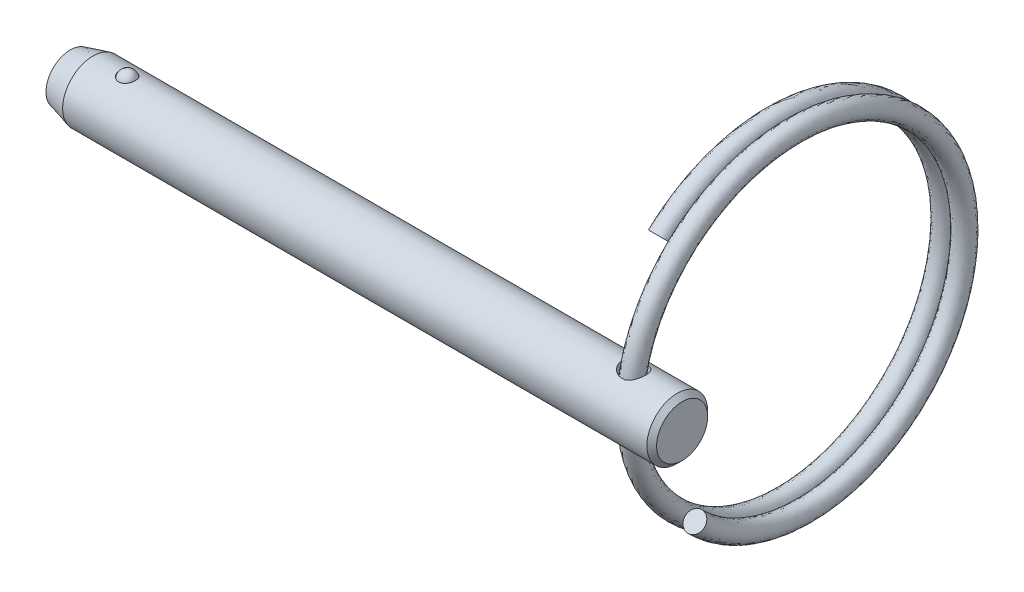
from build123d import *

# Parameters (mm, degrees)
SKETCH4_W             = 0.9525
SKETCH4_H             = 4.7625
SWEEP1_PITCH          = 1.5494
SWEEP1_HEIGHT         = 1.355725
SWEEP1_RADIUS         = 13.462
SKETCH6_R             = 0.762
SWEEP2_PITCH          = 1.5494
SWEEP2_HEIGHT         = 1.355725
SWEEP2_RADIUS         = 13.462
SWEEP2_START_ANGLE    = -180
SKETCH6_2_R           = 0.762
BODY_MOVE_COPY1_ANGLE = 90


with BuildPart() as part:
    # Sketch1 → Revolve1 (revolve)
    with BuildSketch(Plane.XY, mode=Mode.PRIVATE) as revolve1_sk:
        Polygon((23.9649, 2.00025), (23.5839, 2.38125), (-22.187510803, 2.38125), (-23.9649, 1.905), (-23.9649, 0), (23.9649, 0), align=None)
    revolve(revolve1_sk.sketch.rotate(Axis((23.9649, 0, 0), (1, 0, 0)), 90), axis=Axis((23.9649, 0, 0), (1, 0, 0)))

    # Sketch2 → Cut-Revolve1 (revolve, cut)
    with BuildSketch(Plane.XY):
        with BuildLine():
            Line((-18.814844331, 2.143125), (-20.180094331, 2.143125))
            ThreePointArc((-20.180094331, 2.143125), (-19.497469331, 2.82575), (-18.814844331, 2.143125))
        make_face()
    revolve(axis=Axis((-18.814844331, 2.143125, 0), (1, 0, 0)), mode=Mode.SUBTRACT)

    # Sketch4 → Cut-Revolve2 (revolve, cut)
    with BuildSketch(Plane.XY, mode=Mode.PRIVATE) as cut_revolve2_sk:
        with Locations((20.64385, 0)):
            Rectangle(SKETCH4_W, SKETCH4_H)
    revolve(cut_revolve2_sk.sketch.rotate(Axis((20.1676, -2.38125, 0), (0, 1, 0)), 90), axis=Axis((20.1676, -2.38125, 0), (0, 1, 0)), mode=Mode.SUBTRACT)


with BuildPart() as body_2:
    # Sketch3 → Revolve2 (revolve)
    with BuildSketch(Plane.XY):
        with BuildLine():
            Line((-18.840244331, 2.143125), (-20.154694331, 2.143125))
            ThreePointArc((-20.154694331, 2.143125), (-19.497469331, 2.80035), (-18.840244331, 2.143125))
        make_face()
    revolve(axis=Axis((-18.840244331, 2.143125, 0), (1, 0, 0)))


with BuildPart() as body_3:
    # Sweep1: sweep along a helix
    with BuildLine() as sweep1_path:
        Helix(SWEEP1_PITCH, SWEEP1_HEIGHT, SWEEP1_RADIUS, center=(32.747648906, 0, 0), direction=(0, 0, -1), lefthand=True)
    # Sketch6 → Sweep1 (sweep)
    with BuildSketch(Plane(origin=(114.003847968, 0, 0), x_dir=(0, 0, -1), z_dir=(0, 1, 0))):
        with Locations((0, 93.956199061)):
            Circle(SKETCH6_R)
    sweep(path=sweep1_path.line, is_frenet=True)

    # Sweep2: sweep along a helix
    with BuildLine() as sweep2_path:
        add(Helix(SWEEP2_PITCH, SWEEP2_HEIGHT, SWEEP2_RADIUS, center=(32.747648906, 0, 0), direction=(0, 0, 1), lefthand=True, mode=Mode.PRIVATE).rotate(Axis((32.747648906, 0, 0), (0, 0, 1)), SWEEP2_START_ANGLE))
    # Sketch6<2> → Sweep2 (sweep)
    with BuildSketch(Plane(origin=(114.003847968, 0, 0), x_dir=(0, 0, -1), z_dir=(0, 1, 0))):
        with Locations((0, 93.956199061)):
            Circle(SKETCH6_2_R)
    sweep(path=sweep2_path.line, is_frenet=True)


with BuildPart() as body_3_1:
    # Body-Move/Copy1: moved
    add(body_3.part.rotate(Axis((32.747648906, 0, 0), (0, 1, 0)), BODY_MOVE_COPY1_ANGLE))


with BuildPart() as body_3_2:
    # Body-Move/Copy2: moved
    add(body_3_1.part.moved(Location((-12.485589555, 0, -12.326640569))))


solid = Compound([part.part, body_2.part, body_3_2.part])
